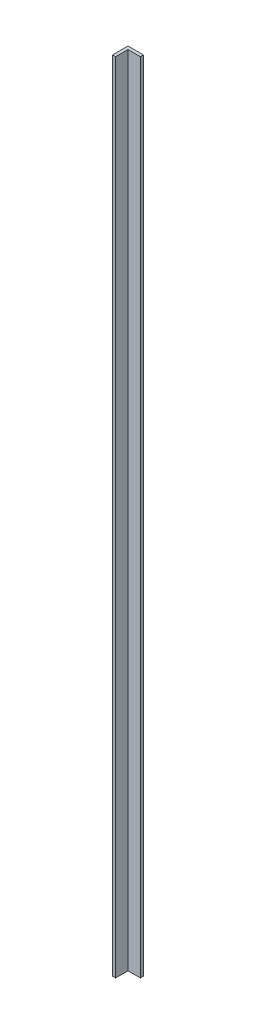
from build123d import *

# Parameters (mm, degrees)
BOSS_EXTRUDE1_DEPTH = 417.068


with BuildPart() as part:
    # Sketch1 → Boss-Extrude1 (new body)
    with BuildSketch(Plane(origin=(0, 0, 0), x_dir=(1, 0, 0), z_dir=(0, 1, 0))):
        Polygon((0, 0), (6.5, 0), (6.5, 1.5875), (-1.5875, 1.5875), (-1.5875, -6.5), (0, -6.5), align=None)
    extrude(amount=BOSS_EXTRUDE1_DEPTH)


solid = part.part
